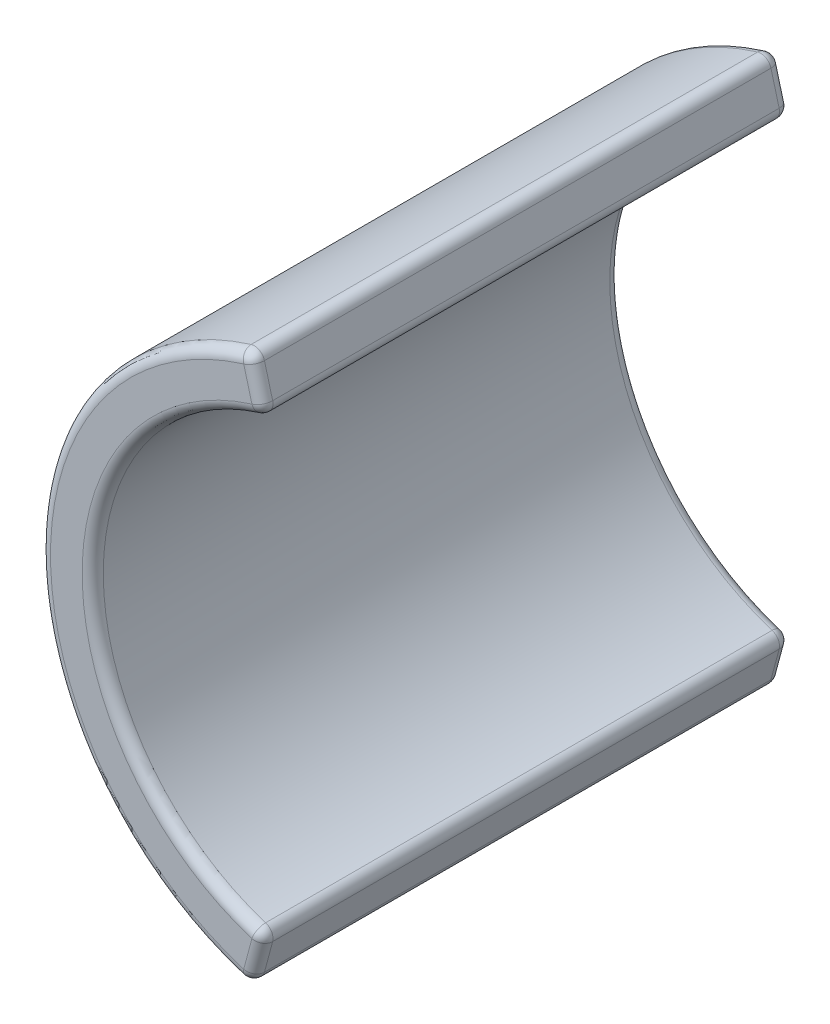
from build123d import *

# Parameters (mm, degrees)
SKETCH1_W      = 2.5
SKETCH1_H      = 25
REVOLVE1_ANGLE = 150
FILLET1_R      = 0.5


with BuildPart() as part:
    # Sketch1 → Revolve1 (revolve, symmetric)
    with BuildSketch(Plane(origin=(0, 0, 0), x_dir=(1, 0, 0), z_dir=(0, 1, 0))) as revolve1_sk:
        with Locations((-12.25, 0)):
            Rectangle(SKETCH1_W, SKETCH1_H)
    revolve(axis=Axis((0, 0, 0), (0, 0, -1)), revolution_arc=REVOLVE1_ANGLE / 2)
    revolve(revolve1_sk.sketch, axis=Axis((0, 0, 0), (0, 0, 1)), revolution_arc=REVOLVE1_ANGLE / 2)

    # Fillet1
    fillet1_edges = [part.edges().sort_by_distance(p)[0] for p in [
        (-13.5, 0, -12.5),
        (-2.847009496, 10.625184089, 0),
        (-3.494057109, 13.039998655, 0),
        (-3.494057109, -13.039998655, 0),
        (-11, 0, -12.5),
        (-13.5, 0, 12.5),
        (-2.847009496, -10.625184089, 0),
        (-11, 0, 12.5),
        (-3.170533303, -11.832591372, -12.5),
        (-3.170533303, -11.832591372, 12.5),
        (-3.170533303, 11.832591372, -12.5),
        (-3.170533303, 11.832591372, 12.5),
    ]]
    fillet(fillet1_edges, radius=FILLET1_R)


solid = part.part
